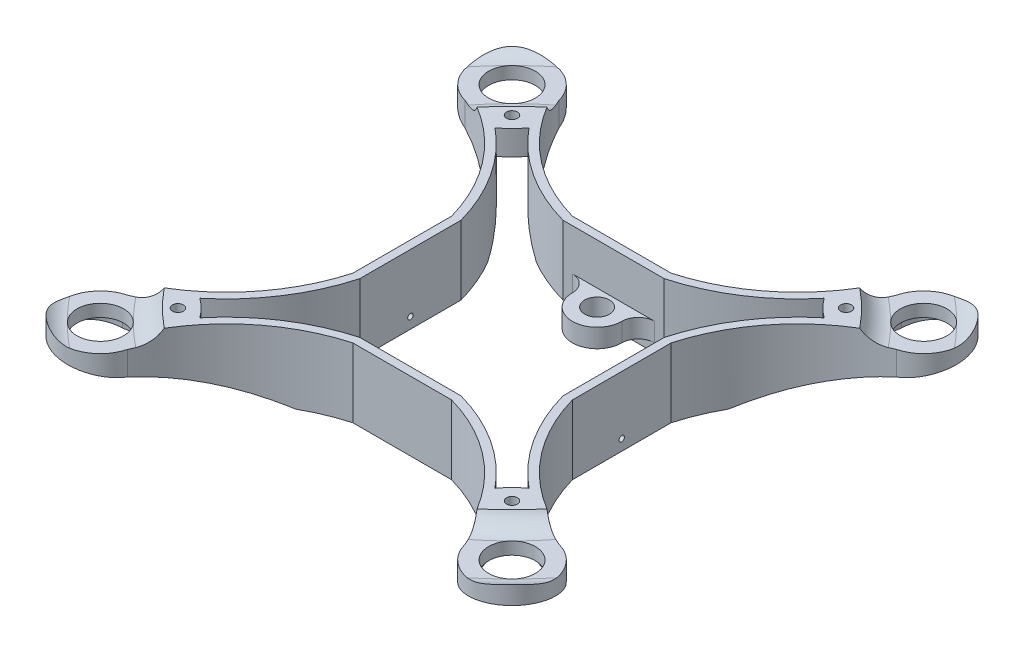
from build123d import *

# Parameters (mm, degrees)
EXTRUDE_1_DEPTH     = 12.6
EXTRUDE_START       = -4.5
EXTRUDE_2_DEPTH     = 4.5
SKETCH_10_R         = 2.25
EXTRUDE_3_DEPTH     = 5
CUT_EXTRUDE_1_DEPTH = 1.6
SKETCH_12_R         = 0.5
CUT_EXTRUDE_2_DEPTH = 63.6
FILLET_1_R          = 3


with BuildPart() as part:
    # 草图1 → 凸台-拉伸1 (new body)
    with BuildSketch(Plane(origin=(0, 0, 0), x_dir=(1, 0, 0), z_dir=(0, 1, 0))):
        with BuildLine():
            ThreePointArc((-9, -20), (-22.091248002, -27.154654746), (-30.738519216, -39.311733316))
            ThreePointArc((-30.738519216, -39.311733316), (-42.449747468, -42.449747468), (-39.311733316, -30.738519216))
            ThreePointArc((-39.311733316, -30.738519216), (-27.154654746, -22.091248002), (-20, -9))
            Line((-20, -9), (-20, 9))
            ThreePointArc((-20, 9), (-27.154654746, 22.091248002), (-39.311733316, 30.738519216))
            ThreePointArc((-39.311733316, 30.738519216), (-42.449747468, 42.449747468), (-30.738519216, 39.311733316))
            ThreePointArc((-30.738519216, 39.311733316), (-22.091248002, 27.154654746), (-9, 20))
            Line((-9, 20), (9, 20))
            ThreePointArc((9, 20), (22.091248002, 27.154654746), (30.738519216, 39.311733316))
            ThreePointArc((30.738519216, 39.311733316), (42.449747468, 42.449747468), (39.311733316, 30.738519216))
            ThreePointArc((39.311733316, 30.738519216), (27.154654746, 22.091248002), (20, 9))
            Line((20, 9), (20, -9))
            ThreePointArc((20, -9), (27.154654746, -22.091248002), (39.311733316, -30.738519216))
            ThreePointArc((39.311733316, -30.738519216), (42.449747468, -42.449747468), (30.738519216, -39.311733316))
            ThreePointArc((30.738519216, -39.311733316), (22.091248002, -27.154654746), (9, -20))
            Line((9, -20), (-9, -20))
        make_face()
        with BuildLine():
            ThreePointArc((-38.83550481, -32.164606209), (-41.389087297, -41.389087297), (-32.164606209, -38.83550481))
            ThreePointArc((-32.164606209, -38.83550481), (-23.048496365, -25.998682467), (-9.204464157, -18.5))
            Line((-9.204464157, -18.5), (9.204464157, -18.5))
            ThreePointArc((9.204464157, -18.5), (23.048496365, -25.998682467), (32.164606209, -38.83550481))
            ThreePointArc((32.164606209, -38.83550481), (41.389087297, -41.389087297), (38.83550481, -32.164606209))
            ThreePointArc((38.83550481, -32.164606209), (25.998682467, -23.048496365), (18.5, -9.204464157))
            Line((18.5, -9.204464157), (18.5, 9.204464157))
            ThreePointArc((18.5, 9.204464157), (25.998682467, 23.048496365), (38.83550481, 32.164606209))
            ThreePointArc((38.83550481, 32.164606209), (41.389087297, 41.389087297), (32.164606209, 38.83550481))
            ThreePointArc((32.164606209, 38.83550481), (23.048496365, 25.998682467), (9.204464157, 18.5))
            Line((9.204464157, 18.5), (-9.204464157, 18.5))
            ThreePointArc((-9.204464157, 18.5), (-23.048496365, 25.998682467), (-32.164606209, 38.83550481))
            ThreePointArc((-32.164606209, 38.83550481), (-41.389087297, 41.389087297), (-38.83550481, 32.164606209))
            ThreePointArc((-38.83550481, 32.164606209), (-25.998682467, 23.048496365), (-18.5, 9.204464157))
            Line((-18.5, 9.204464157), (-18.5, -9.204464157))
            ThreePointArc((-18.5, -9.204464157), (-25.998682467, -23.048496365), (-38.83550481, -32.164606209))
        make_face(mode=Mode.SUBTRACT)
    extrude(amount=EXTRUDE_1_DEPTH)

    # 草图6 → 凸台-拉伸2 (add)
    # profile 1 of 4: a face of its own
    with BuildSketch(Plane(origin=(0, 12.6, 0), x_dir=(1, 0, 0), z_dir=(0, 1, 0)).offset(EXTRUDE_START)):
        with BuildLine():
            ThreePointArc((-29.989569551, 26.888994653), (-28.307611845, 28.307611845), (-26.888994653, 29.989569551))
            ThreePointArc((-26.888994653, 29.989569551), (-29.856231952, 34.216068104), (-32.164606209, 38.83550481))
            ThreePointArc((-32.164606209, 38.83550481), (-41.389087297, 41.389087297), (-38.83550481, 32.164606209))
            ThreePointArc((-38.83550481, 32.164606209), (-34.216068104, 29.856231952), (-29.989569551, 26.888994653))
        make_face()
        with BuildLine():
            ThreePointArc((-29.428932188, 30.428932188), (-30.81161562, 29.505052656), (-31.136038969, 31.136038969))
            ThreePointArc((-31.136038969, 31.136038969), (-30.046248756, 31.352811721), (-29.428932188, 30.428932188))
        make_face(mode=Mode.SUBTRACT)
        with BuildLine():
            ThreePointArc((-33.25, 37.5), (-33.573511987, 35.873595412), (-34.49479618, 34.49479618))
            ThreePointArc((-34.49479618, 34.49479618), (-41.426488013, 39.126404588), (-33.25, 37.5))
        make_face(mode=Mode.SUBTRACT)
    # profile 2 of 4: a face of its own
    with BuildSketch(Plane(origin=(0, 12.6, 0), x_dir=(1, 0, 0), z_dir=(0, 1, 0)).offset(EXTRUDE_START)):
        with BuildLine():
            ThreePointArc((32.164606209, 38.83550481), (29.856231952, 34.216068104), (26.888994653, 29.989569551))
            ThreePointArc((26.888994653, 29.989569551), (28.307611845, 28.307611845), (29.989569551, 26.888994653))
            ThreePointArc((29.989569551, 26.888994653), (34.216068104, 29.856231952), (38.83550481, 32.164606209))
            ThreePointArc((38.83550481, 32.164606209), (41.389087297, 41.389087297), (32.164606209, 38.83550481))
        make_face()
        with BuildLine():
            ThreePointArc((31.428932188, 30.428932188), (29.505052656, 30.046248756), (31.136038969, 31.136038969))
            ThreePointArc((31.136038969, 31.136038969), (31.352811721, 30.81161562), (31.428932188, 30.428932188))
        make_face(mode=Mode.SUBTRACT)
        with BuildLine():
            ThreePointArc((41.75, 37.5), (39.126404588, 33.573511987), (34.49479618, 34.49479618))
            ThreePointArc((34.49479618, 34.49479618), (35.873595412, 41.426488013), (41.75, 37.5))
        make_face(mode=Mode.SUBTRACT)
    # profile 3 of 4: a face of its own
    with BuildSketch(Plane(origin=(0, 12.6, 0), x_dir=(1, 0, 0), z_dir=(0, 1, 0)).offset(EXTRUDE_START)):
        with BuildLine():
            ThreePointArc((38.83550481, -32.164606209), (34.216068104, -29.856231952), (29.989569551, -26.888994653))
            ThreePointArc((29.989569551, -26.888994653), (28.307611845, -28.307611845), (26.888994653, -29.989569551))
            ThreePointArc((26.888994653, -29.989569551), (29.856231952, -34.216068104), (32.164606209, -38.83550481))
            ThreePointArc((32.164606209, -38.83550481), (41.389087297, -41.389087297), (38.83550481, -32.164606209))
        make_face()
        with BuildLine():
            ThreePointArc((41.75, -37.5), (35.873595412, -41.426488013), (34.49479618, -34.49479618))
            ThreePointArc((34.49479618, -34.49479618), (39.126404588, -33.573511987), (41.75, -37.5))
        make_face(mode=Mode.SUBTRACT)
        with BuildLine():
            ThreePointArc((31.428932188, -30.428932188), (31.352811721, -30.81161562), (31.136038969, -31.136038969))
            ThreePointArc((31.136038969, -31.136038969), (29.505052656, -30.046248756), (31.428932188, -30.428932188))
        make_face(mode=Mode.SUBTRACT)
    # profile 4 of 4: a face of its own
    with BuildSketch(Plane(origin=(0, 12.6, 0), x_dir=(1, 0, 0), z_dir=(0, 1, 0)).offset(EXTRUDE_START)):
        with BuildLine():
            ThreePointArc((-26.888994653, -29.989569551), (-28.307611845, -28.307611845), (-29.989569551, -26.888994653))
            ThreePointArc((-29.989569551, -26.888994653), (-34.216068104, -29.856231952), (-38.83550481, -32.164606209))
            ThreePointArc((-38.83550481, -32.164606209), (-41.389087297, -41.389087297), (-32.164606209, -38.83550481))
            ThreePointArc((-32.164606209, -38.83550481), (-29.856231952, -34.216068104), (-26.888994653, -29.989569551))
        make_face()
        with BuildLine():
            ThreePointArc((-33.25, -37.5), (-41.426488013, -39.126404588), (-34.49479618, -34.49479618))
            ThreePointArc((-34.49479618, -34.49479618), (-33.573511987, -35.873595412), (-33.25, -37.5))
        make_face(mode=Mode.SUBTRACT)
        with BuildLine():
            ThreePointArc((-29.428932188, -30.428932188), (-30.046248756, -31.352811721), (-31.136038969, -31.136038969))
            ThreePointArc((-31.136038969, -31.136038969), (-30.81161562, -29.505052656), (-29.428932188, -30.428932188))
        make_face(mode=Mode.SUBTRACT)
    extrude(amount=EXTRUDE_2_DEPTH)

    # 草图4 → 切除-旋转1 (revolve, cut)
    with BuildSketch(Plane(origin=(0, 0, 0), x_dir=(-0.7071067811865474, 0, 0.7071067811865477), z_dir=(-0.7071067811865477, 0, -0.7071067811865474))):
        with BuildLine():
            Line((-45.033008589, 12.6), (-53.033008589, 12.6))
            Line((-53.033008589, 12.6), (-61.033008589, 12.6))
            ThreePointArc((-61.033008589, 12.6), (-59.437431597, 11.009294987), (-57.283008589, 10.35))
            Line((-57.283008589, 10.35), (-56.783008589, 10.35))
            Line((-56.783008589, 10.35), (-53.033008589, 10.35))
            Line((-53.033008589, 10.35), (-49.283008589, 10.35))
            Line((-49.283008589, 10.35), (-48.783008589, 10.35))
            ThreePointArc((-48.783008589, 10.35), (-46.628585581, 11.009294987), (-45.033008589, 12.6))
        make_face()
    revolve(axis=Axis((0, 0, 0), (0, 1, 0)), mode=Mode.SUBTRACT)

    # 草图7 → 切除-旋转6 (revolve, cut)
    with BuildSketch(Plane(origin=(0, 0, 0), x_dir=(-0.7071067811865474, 0, -0.7071067811865477), z_dir=(0.7071067811865477, 0, -0.7071067811865474))):
        with BuildLine():
            Line((-53.033008589, 0), (-60.033008589, 0))
            Line((-60.033008589, 0), (-60.033008589, 8.1))
            ThreePointArc((-60.033008589, 8.1), (-44.021826577, 4.577953422), (-28.28, 0))
            Line((-28.28, 0), (-53.033008589, 0))
        make_face()
    revolve(axis=Axis((0, 0, 0), (0, 1, 0)), mode=Mode.SUBTRACT)

    # 草图10 → 凸台-拉伸3 (add)
    with BuildSketch(Plane.XZ):
        with BuildLine():
            Line((4.5, -18.5), (4.5, -15.5))
            ThreePointArc((4.5, -15.5), (0, -11), (-4.5, -15.5))
            Line((-4.5, -15.5), (-4.5, -18.5))
            Line((-4.5, -18.5), (0, -18.5))
            Line((0, -18.5), (4.5, -18.5))
        make_face()
        with Locations(Location((0, -15.5, 0), (0, 0, 270))):
            Circle(SKETCH_10_R, mode=Mode.SUBTRACT)
    extrude(amount=-EXTRUDE_3_DEPTH)

    # 草图11 → 切除-拉伸1 (cut)
    with BuildSketch(Plane.XZ):
        with BuildLine():
            Line((-4.5, -18.5), (4.5, -18.5))
            Line((4.5, -18.5), (4.5, -15.5))
            ThreePointArc((4.5, -15.5), (0, -11), (-4.5, -15.5))
            Line((-4.5, -15.5), (-4.5, -18.5))
        make_face()
    extrude(amount=-CUT_EXTRUDE_1_DEPTH, mode=Mode.SUBTRACT)

    # 草图12 → 切除-拉伸2 (cut)
    with BuildSketch(Plane.ZY.offset(20)):
        with Locations(Location((0, 2, 0), (0, 0, 180))):
            Circle(SKETCH_12_R)
    extrude(amount=-CUT_EXTRUDE_2_DEPTH, mode=Mode.SUBTRACT)

    # 圆角1
    fillet_1_edges = [part.edges().sort_by_distance(p)[0] for p in [
        (4.5, 3.3, -18.5),
        (-4.5, 3.3, -18.5),
    ]]
    fillet(fillet_1_edges, radius=FILLET_1_R - 0.0001)  # a hair under: the kernel refuses the full size


solid = part.part
